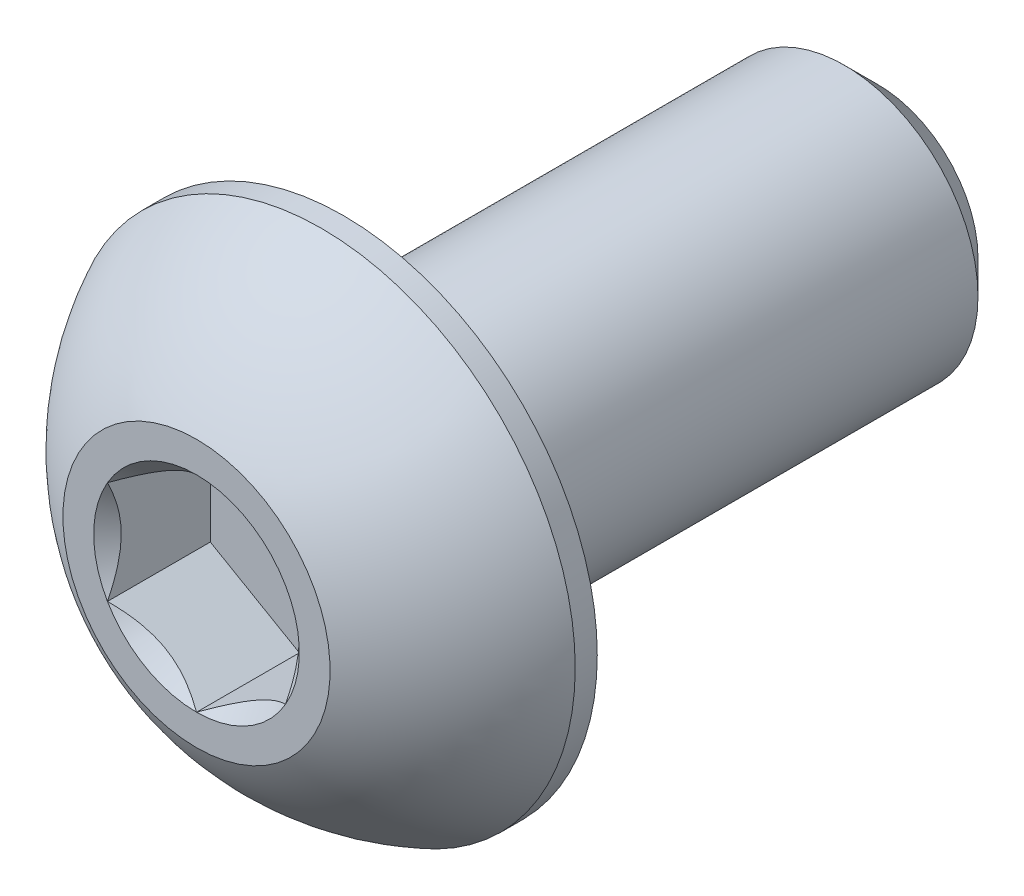
from build123d import *

# Parameters (mm, degrees)
CUT_EXTRUDE2_DEPTH = 1.155


with BuildPart() as part:
    # Sketch10 → Revolve3 (revolve)
    with BuildSketch(Plane(origin=(0, 0, 0), x_dir=(0, 0, -1), z_dir=(1, 0, 0))):
        Polygon((7.275, 1.5), (7.65, 1.125), (7.65, 0), (1.65, 0), (1.65, 1.5), align=None)
    revolve(axis=Axis((0, 0, 0), (0, 0, -1)))

    # Sketch7 → Revolve2 (revolve)
    with BuildSketch(Plane(origin=(0, 0, 0), x_dir=(0, 0, -1), z_dir=(1, 0, 0))):
        with BuildLine():
            Line((1.4025, 2.85), (1.65, 2.85))
            Line((1.65, 2.85), (1.65, 0))
            Line((1.65, 0), (0, 0))
            Line((0, 0), (0, 1.5))
            ThreePointArc((0, 1.5), (0.59512511, 2.285251969), (1.4025, 2.85))
        make_face()
    revolve(axis=Axis((0, 0, 0), (0, 0, -1)))

    # Sketch5 → Cut-Extrude2 (cut)
    with BuildSketch(Plane.XY):
        Polygon((1, -0.577350269), (1, 0.577350269), (0, 1.154700538), (-1, 0.577350269), (-1, -0.577350269), (0, -1.154700538), align=None)
    extrude(amount=-CUT_EXTRUDE2_DEPTH, mode=Mode.SUBTRACT)

    # Cut-Extrude3 cone 1 section (through the dimple's axis) → Cut-Extrude3 (revolve, cut)
    with BuildSketch(Plane(origin=(0, 0, 0), x_dir=(0, -1, 0), z_dir=(1, 0, 0))):
        Polygon((0, 0), (1.154700538, 0), (0, 1.154700538), align=None)
    revolve(axis=Axis((0, 0, 0), (0, 0, -1)), mode=Mode.SUBTRACT)


solid = part.part
